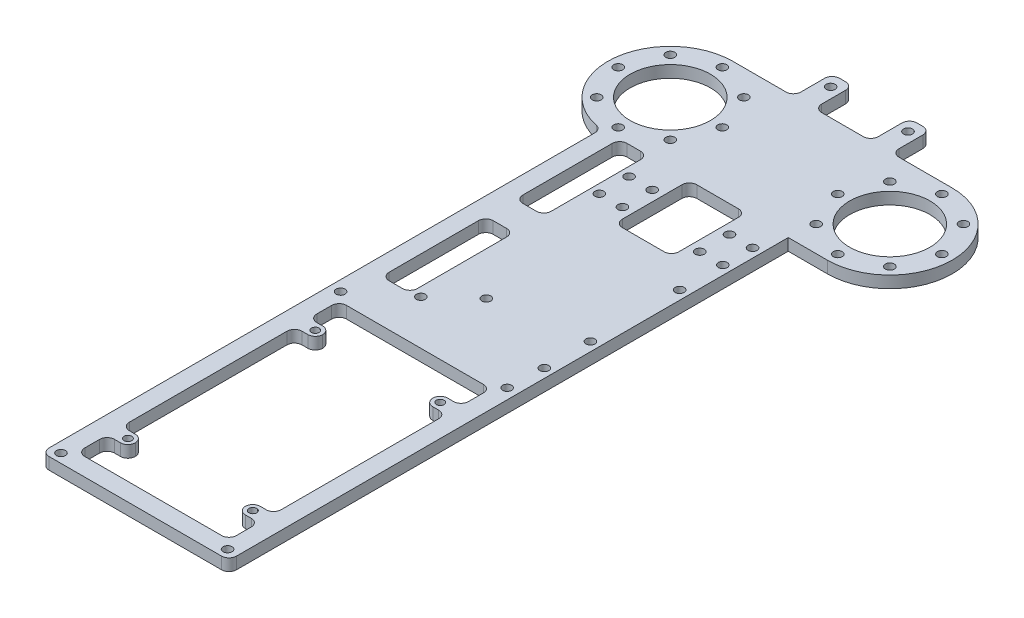
from build123d import *

# Parameters (mm, degrees)
SKETCH_1_R          = 13.5
SKETCH_1_R_2        = 1.5
SKETCH_1_R_3        = 1.3
EXTRUDE_1_DEPTH     = 4
SKETCH_2_W          = 19
SKETCH_2_H          = 13
SKETCH_2_W_2        = 9.5
SKETCH_2_H_2        = 35
SKETCH_2_H_3        = 25
CUT_EXTRUDE_1_DEPTH = 152.091561644
FILLET_1_R          = 2.5


with BuildPart() as part:
    # 草图1 → 凸台-拉伸1 (new body)
    with BuildSketch(Plane(origin=(0, 0, 0), x_dir=(1, 0, 0), z_dir=(0, 1, 0))):
        with BuildLine():
            Line((16.5, 103.5), (-16.5, 103.5))
            Line((-16.5, 103.5), (-16.5, 90.5))
            Line((-16.5, 90.5), (-36.9, 90.5))
            ThreePointArc((-36.9, 90.5), (-57.866998484, 70.67684942), (-39.25, 48.631902339))
            Line((-39.25, 48.631902339), (-39.25, -39.5))
            Line((-39.25, -39.5), (-39.25, -139.5))
            Line((-39.25, -139.5), (23.75, -139.5))
            Line((23.75, -139.5), (23.75, -39.5))
            Line((23.75, -39.5), (23.75, -34.5))
            Line((23.75, -34.5), (23.75, 34.5))
            Line((23.75, 34.5), (23.75, 48.5))
            Line((23.75, 48.5), (36.9, 48.5))
            ThreePointArc((36.9, 48.5), (57.9, 69.5), (36.9, 90.5))
            Line((36.9, 90.5), (16.5, 90.5))
            Line((16.5, 90.5), (16.5, 103.5))
        make_face()
        with Locations(Location((-36.9, 69.5, 0), (0, 0, 270))):
            Circle(SKETCH_1_R, mode=Mode.SUBTRACT)
        with Locations(Location((-36.9, 87, 0), (0, 0, 270))):
            Circle(SKETCH_1_R_2, mode=Mode.SUBTRACT)
        with Locations(Location((-24.525631329, 81.874368671, 0), (0, 0, 270))):
            Circle(SKETCH_1_R_2, mode=Mode.SUBTRACT)
        with Locations(Location((-19.4, 69.5, 0), (0, 0, 270))):
            Circle(SKETCH_1_R_2, mode=Mode.SUBTRACT)
        with Locations(Location((-24.525631329, 57.125631329, 0), (0, 0, 270))):
            Circle(SKETCH_1_R_2, mode=Mode.SUBTRACT)
        with Locations(Location((-36.9, 52, 0), (0, 0, 270))):
            Circle(SKETCH_1_R_2, mode=Mode.SUBTRACT)
        with Locations(Location((-49.274368671, 57.125631329, 0), (0, 0, 270))):
            Circle(SKETCH_1_R_2, mode=Mode.SUBTRACT)
        with Locations(Location((-54.4, 69.5, 0), (0, 0, 270))):
            Circle(SKETCH_1_R_2, mode=Mode.SUBTRACT)
        with Locations(Location((-49.274368671, 81.874368671, 0), (0, 0, 270))):
            Circle(SKETCH_1_R_2, mode=Mode.SUBTRACT)
        with Locations(Location((-13, 99.5, 0), (0, 0, 270))):
            Circle(SKETCH_1_R_2, mode=Mode.SUBTRACT)
        with Locations(Location((-13, 39.5, 0), (0, 0, 270))):
            Circle(SKETCH_1_R_2, mode=Mode.SUBTRACT)
        with Locations(Location((13, 39.5, 0), (0, 0, 90))):
            Circle(SKETCH_1_R_2, mode=Mode.SUBTRACT)
        with Locations(Location((13, 99.5, 0), (0, 0, 90))):
            Circle(SKETCH_1_R_2, mode=Mode.SUBTRACT)
        with Locations(Location((54.4, 69.5, 0), (0, 0, 90))):
            Circle(SKETCH_1_R_2, mode=Mode.SUBTRACT)
        with Locations(Location((49.274368671, 57.125631329, 0), (0, 0, 90))):
            Circle(SKETCH_1_R_2, mode=Mode.SUBTRACT)
        with Locations(Location((36.9, 52, 0), (0, 0, 90))):
            Circle(SKETCH_1_R_2, mode=Mode.SUBTRACT)
        with Locations(Location((24.525631329, 57.125631329, 0), (0, 0, 90))):
            Circle(SKETCH_1_R_2, mode=Mode.SUBTRACT)
        with Locations(Location((19.4, 69.5, 0), (0, 0, 90))):
            Circle(SKETCH_1_R_2, mode=Mode.SUBTRACT)
        with Locations(Location((24.525631329, 81.874368671, 0), (0, 0, 90))):
            Circle(SKETCH_1_R_2, mode=Mode.SUBTRACT)
        with Locations(Location((36.9, 87, 0), (0, 0, 90))):
            Circle(SKETCH_1_R_2, mode=Mode.SUBTRACT)
        with Locations(Location((49.274368671, 81.874368671, 0), (0, 0, 90))):
            Circle(SKETCH_1_R_2, mode=Mode.SUBTRACT)
        with Locations(Location((36.9, 69.5, 0), (0, 0, 90))):
            Circle(SKETCH_1_R, mode=Mode.SUBTRACT)
        with Locations(Location((-13, 29.5, 0), (0, 0, 270))):
            Circle(SKETCH_1_R_2, mode=Mode.SUBTRACT)
        with Locations(Location((-35.75, -42.5, 0), (0, 0, 270))):
            Circle(SKETCH_1_R_2, mode=Mode.SUBTRACT)
        with Locations(Location((-35.75, -136.5, 0), (0, 0, 90))):
            Circle(SKETCH_1_R_2, mode=Mode.SUBTRACT)
        with Locations(Location((20.25, -136.5, 0), (0, 0, 270))):
            Circle(SKETCH_1_R_2, mode=Mode.SUBTRACT)
        with Locations(Location((20.25, -42.5, 0), (0, 0, 90))):
            Circle(SKETCH_1_R_2, mode=Mode.SUBTRACT)
        with Locations(Location((13, 29.5, 0), (0, 0, 90))):
            Circle(SKETCH_1_R_2, mode=Mode.SUBTRACT)
        with Locations(Location((20.75, 15, 0), (0, 0, 270))):
            Circle(SKETCH_1_R_2, mode=Mode.SUBTRACT)
        with Locations(Location((20.75, -15, 0), (0, 0, 90))):
            Circle(SKETCH_1_R_2, mode=Mode.SUBTRACT)
        with Locations(Location((-28.75, -58, 0), (0, 0, 270))):
            Circle(SKETCH_1_R_3, mode=Mode.SUBTRACT)
        with Locations(Location((-28.75, -121, 0), (0, 0, 90))):
            Circle(SKETCH_1_R_3, mode=Mode.SUBTRACT)
        with Locations(Location((13.25, -121, 0), (0, 0, 270))):
            Circle(SKETCH_1_R_3, mode=Mode.SUBTRACT)
        with Locations(Location((13.25, -58, 0), (0, 0, 90))):
            Circle(SKETCH_1_R_3, mode=Mode.SUBTRACT)
        with Locations(Location((-9.25, -20, 0), (0, 0, 270))):
            Circle(SKETCH_1_R_2, mode=Mode.SUBTRACT)
        with Locations(Location((20.75, 39.5, 0), (0, 0, 270))):
            Circle(SKETCH_1_R_2, mode=Mode.SUBTRACT)
        with Locations(Location((-20.75, 39.5, 0), (0, 0, 90))):
            Circle(SKETCH_1_R_2, mode=Mode.SUBTRACT)
        with Locations(Location((20.75, 29.5, 0), (0, 0, 90))):
            Circle(SKETCH_1_R_2, mode=Mode.SUBTRACT)
        with Locations(Location((-20.75, 29.5, 0), (0, 0, 270))):
            Circle(SKETCH_1_R_2, mode=Mode.SUBTRACT)
        with Locations(Location((20.75, -30.5, 0), (0, 0, 90))):
            Circle(SKETCH_1_R_2, mode=Mode.SUBTRACT)
        with Locations(Location((-20.75, -30.5, 0), (0, 0, 270))):
            Circle(SKETCH_1_R_2, mode=Mode.SUBTRACT)
    extrude(amount=EXTRUDE_1_DEPTH)

    # 草图2 → 切除-拉伸1 (cut, through all)
    with BuildSketch(Plane(origin=(0, 4, 0), x_dir=(1, 0, 0), z_dir=(0, 1, 0))):
        with Locations((0, 97)):
            Rectangle(SKETCH_2_W, SKETCH_2_H)
        Polygon((-33.25, -45.5), (17.75, -45.5), (17.75, -55.5), (10.75, -55.5), (10.75, -60.5), (17.75, -60.5), (17.75, -118.5), (10.75, -118.5), (10.75, -123.5), (17.75, -123.5), (17.75, -133.5), (-33.25, -133.5), (-33.25, -123.5), (-26.25, -123.5), (-26.25, -118.5), (-33.25, -118.5), (-33.25, -60.5), (-26.25, -60.5), (-26.25, -55.5), (-33.25, -55.5), align=None)
        with Locations((-28.5, 31.319634916)):
            Rectangle(SKETCH_2_W_2, SKETCH_2_H_2)
        with Locations((-28.5, -13.680365084)):
            Rectangle(SKETCH_2_W_2, SKETCH_2_H_2)
        with Locations((0, 36)):
            Rectangle(SKETCH_2_W, SKETCH_2_H_3)
    extrude(amount=-CUT_EXTRUDE_1_DEPTH, mode=Mode.SUBTRACT)

    # 圆角1
    fillet_1_edges = [part.edges().sort_by_distance(p)[0] for p in [
        (23.75, 2, 139.5),
        (-39.25, 2, 139.5),
        (-33.25, 2, 123.5),
        (-26.25, 2, 123.5),
        (-33.25, 2, 118.5),
        (-26.25, 2, 118.5),
        (-33.25, 2, 133.5),
        (17.75, 2, 133.5),
        (17.75, 2, 123.5),
        (10.75, 2, 123.5),
        (10.75, 2, 118.5),
        (17.75, 2, 118.5),
        (17.75, 2, 55.5),
        (17.75, 2, 60.5),
        (10.75, 2, 60.5),
        (10.75, 2, 55.5),
        (-33.25, 2, 60.5),
        (-26.25, 2, 60.5),
        (-26.25, 2, 55.5),
        (-33.25, 2, 55.5),
        (17.75, 2, 45.5),
        (-33.25, 2, 45.5),
        (-33.25, 2, 31.180365084),
        (-23.75, 2, 31.180365084),
        (-23.75, 2, -13.819634916),
        (-33.25, 2, -13.819634916),
        (-23.75, 2, -3.819634916),
        (-33.25, 2, -3.819634916),
        (-33.25, 2, -48.819634916),
        (-23.75, 2, -48.819634916),
        (-39.25, 2, -48.631902339),
        (-16.5, 2, -90.5),
        (9.5, 2, -90.5),
        (16.5, 2, -90.5),
        (16.5, 2, -103.5),
        (9.5, 2, -103.5),
        (-9.5, 2, -90.5),
        (-9.5, 2, -103.5),
        (-16.5, 2, -103.5),
        (-9.5, 2, -23.5),
        (9.5, 2, -23.5),
        (9.5, 2, -48.5),
        (-9.5, 2, -48.5),
    ]]
    fillet(fillet_1_edges, radius=FILLET_1_R - 0.0001)  # a hair under: the kernel refuses the full size


solid = part.part
